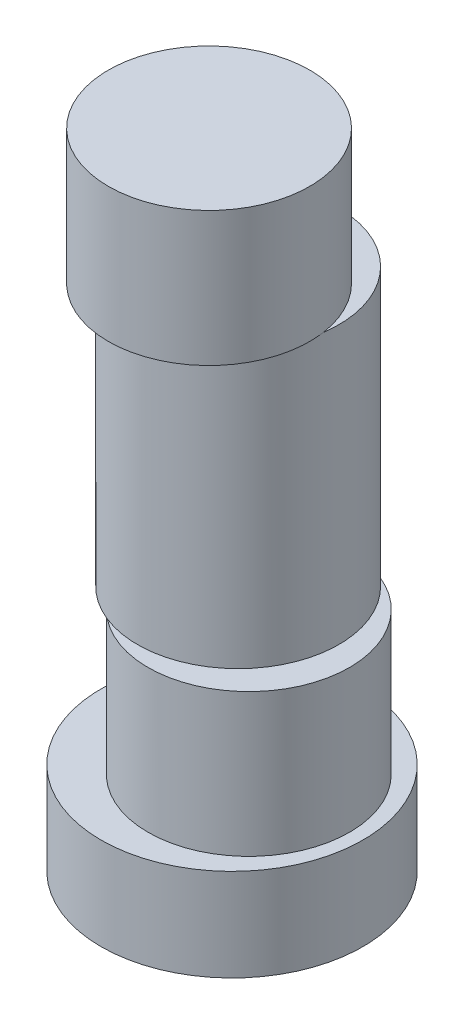
from build123d import *

# Parameters (mm, degrees)
SKETCH1_R           = 7.8
BOSS_EXTRUDE1_DEPTH = 5.5
SKETCH2_R           = 6
BOSS_EXTRUDE2_DEPTH = 8.5
SKETCH4_R           = 6
BOSS_EXTRUDE3_DEPTH = 16.5
SKETCH3_R           = 3
CUT_EXTRUDE2_DEPTH  = 33.433470366
SKETCH7_R           = 6
BOSS_EXTRUDE4_DEPTH = 8


with BuildPart() as part:
    # Sketch1 → Boss-Extrude1 (new body)
    with BuildSketch(Plane(origin=(0, 0, 0), x_dir=(1, 0, 0), z_dir=(0, 1, 0))):
        Circle(SKETCH1_R)
    extrude(amount=BOSS_EXTRUDE1_DEPTH)

    # Sketch2 → Boss-Extrude2 (add)
    with BuildSketch(Plane(origin=(0, 5.5, 0), x_dir=(1, 0, 0), z_dir=(0, 1, 0))):
        with Locations((1, 0)):
            Circle(SKETCH2_R)
    extrude(amount=BOSS_EXTRUDE2_DEPTH)

    # Sketch4 → Boss-Extrude3 (add)
    with BuildSketch(Plane(origin=(0, 14, 0), x_dir=(1, 0, 0), z_dir=(0, 1, 0))):
        with Locations((-0.5, 0.866025404)):
            Circle(SKETCH4_R)
    extrude(amount=BOSS_EXTRUDE3_DEPTH)

    # Sketch3 → Cut-Extrude2 (cut, through all)
    with BuildSketch(Plane.XZ):
        Circle(SKETCH3_R)
    extrude(amount=-CUT_EXTRUDE2_DEPTH, mode=Mode.SUBTRACT)

    # Sketch7 → Boss-Extrude4 (add)
    with BuildSketch(Plane(origin=(0, 30.5, 0), x_dir=(1, 0, 0), z_dir=(0, 1, 0))):
        with Locations((-0.5, -0.866025404)):
            Circle(SKETCH7_R)
    extrude(amount=BOSS_EXTRUDE4_DEPTH)


solid = part.part
